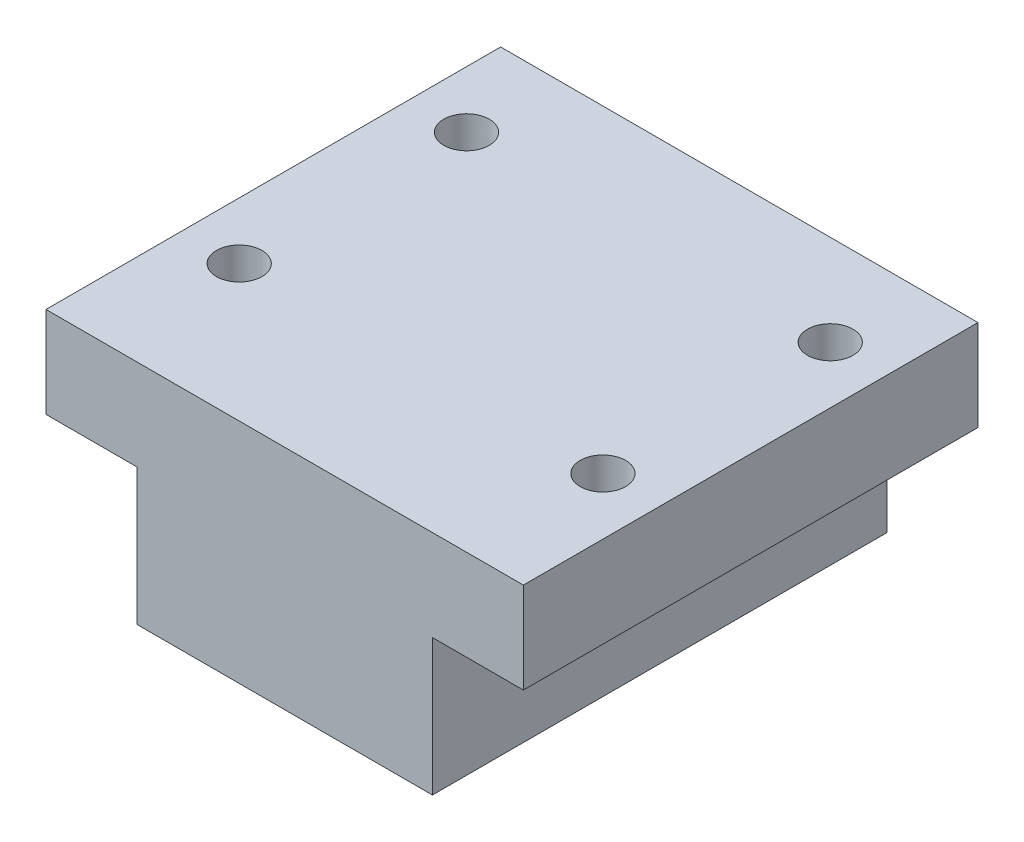
from build123d import *

# Parameters (mm, degrees)
BOSS_EXTRUDE1_DEPTH = 20
SKETCH2_R           = 2
CUT_EXTRUDE1_DEPTH  = 40
SKETCH4_R           = 5.5
CUT_EXTRUDE2_DEPTH  = 1.75


with BuildPart() as part:
    # Sketch1 → Boss-Extrude1 (new, symmetric)
    with BuildSketch(Plane.XY):
        Polygon((13, -4), (21, -4), (21, 4), (-21, 4), (-21, -4), (-13, -4), (-13, -16), (13, -16), align=None)
    extrude(amount=BOSS_EXTRUDE1_DEPTH, both=True)

    # Sketch2 → Cut-Extrude1 (cut)
    with BuildSketch(Plane(origin=(0, 4, 0), x_dir=(1, 0, 0), z_dir=(0, 1, 0))):
        with Locations((-16, 12)):
            Circle(SKETCH2_R)
        with Locations((16, 12)):
            Circle(SKETCH2_R)
        with Locations((-16, -8)):
            Circle(SKETCH2_R)
        with Locations((16, -8)):
            Circle(SKETCH2_R)
    extrude(amount=-CUT_EXTRUDE1_DEPTH, mode=Mode.SUBTRACT)

    # Sketch4 → Cut-Extrude2 (cut)
    with BuildSketch(Plane.XZ.offset(16)):
        with Locations((0, -4.5)):
            Circle(SKETCH4_R)
    extrude(amount=-CUT_EXTRUDE2_DEPTH, mode=Mode.SUBTRACT)


solid = part.part
